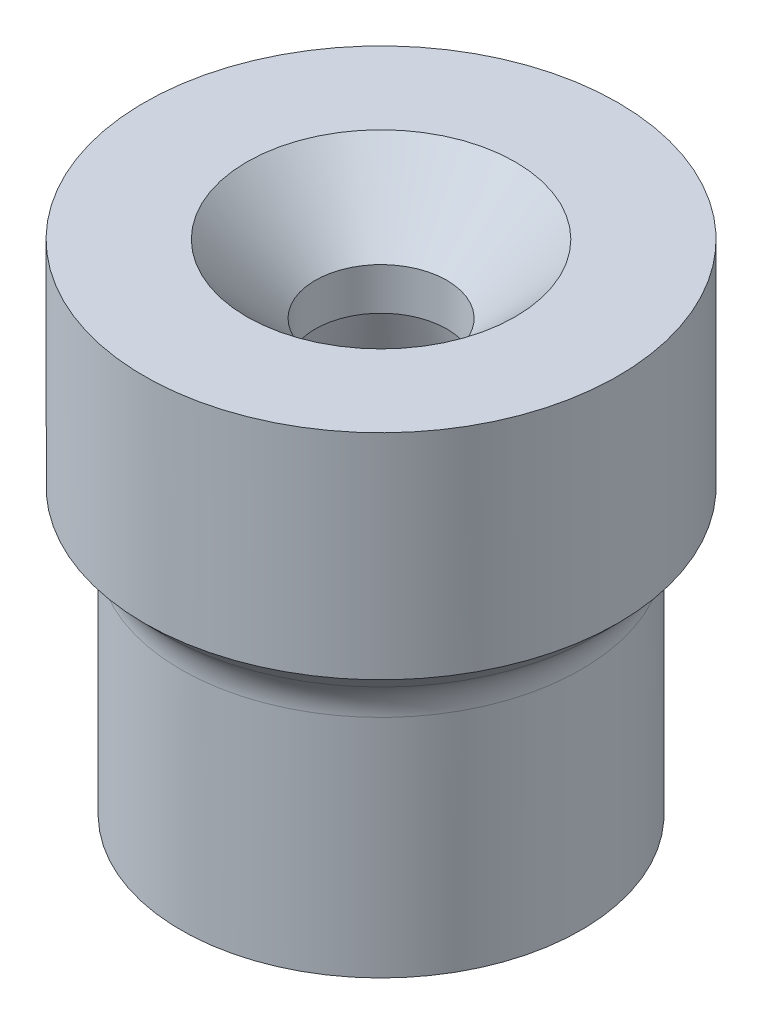
from build123d import *

# Parameters (mm, degrees)
SCHIZZO4_W  = 25
SCHIZZO4_H  = 30
RACCORDO1_R = 10


with BuildPart() as part:
    # Schizzo1 → Rivoluzione1 (revolve)
    with BuildSketch(Plane.XY):
        Polygon((-38, 0), (-32.234492396, 0), (-12.5, 73.650128282), (-12.5, 81.650128282), (-25.490381057, 94.640509339), (-63, 94.640509339), (-38, 64.640509339), align=None)
    revolve(axis=Axis((0, 0, 0), (0, 1, 0)))

    # Schizzo4 → Taglia-Rivoluzione3 (revolve, cut)
    with BuildSketch(Plane.XY):
        with Locations((-50.5, 79.640509339)):
            Rectangle(SCHIZZO4_W, SCHIZZO4_H)
    revolve(axis=Axis((0, 0, 0), (0, 1, 0)), mode=Mode.SUBTRACT)

    # Schizzo5 → Rivoluzione2 (revolve)
    with BuildSketch(Plane.XY):
        Polygon((-38, 94.640509339), (-45, 94.640509339), (-45, 54), (-38, 47), align=None)
    revolve(axis=Axis((0, 0, 0), (0, 1, 0)))

    # Raccordo1
    raccordo1_edges = [part.edges().sort_by_distance(p)[0] for p in [
        (38, 47, 0),
    ]]
    fillet(raccordo1_edges, radius=RACCORDO1_R)


solid = part.part
